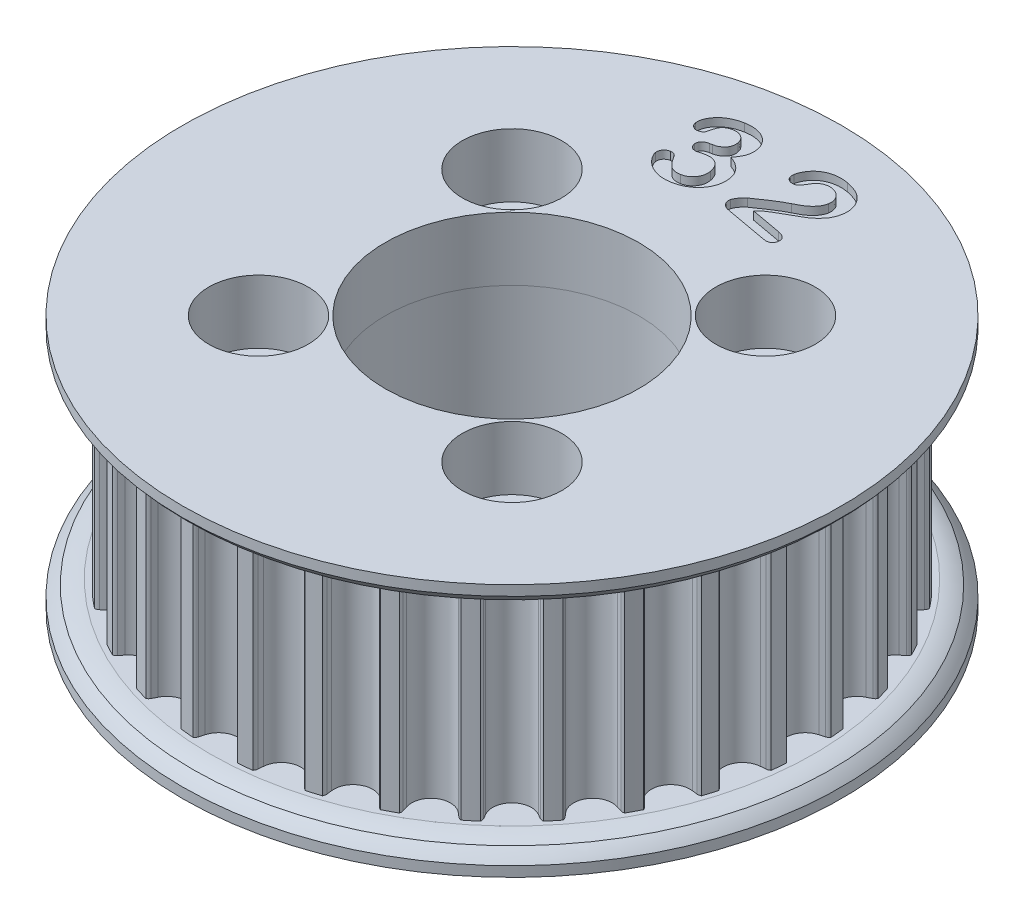
from build123d import *

# Parameters (mm, degrees)
SKETCH1_R                    = 14.897875026
TOOTHOD_DEPTH                = 5.08
TOOTHPROFILE_DEPTH           = 22.672557776
TOOTHPATTERN_COUNT           = 32
LARGE_TOOTH_COUNT_DEPTH      = 27.579130911
LARGE_TOOTH_COUNT_DEPTH_BACK = 0.4
CUT_EXTRUDE1_DEPTH           = 9.525
SKETCH15_R                   = 6.35
BOSS_EXTRUDE1_DEPTH          = 9.525
SKETCH16_R                   = 6.35
SKETCH16_R_2                 = 2.4892
CUT_EXTRUDE2_DEPTH           = 27.579131036
SKETCH17_R                   = 2.0193
CUT_EXTRUDE3_DEPTH           = 26.216776789
CIRPATTERN1_START            = -6.35
CIRPATTERN1_OUTLINE_R        = 2.0193
CIRPATTERN1_DEPTH            = 12.7
CIRPATTERN1_START_2          = 3.175
CIRPATTERN1_2_OUTLINE_R      = 2.4892
CIRPATTERN1_2_OUTLINE_R_2    = 2.0193
CIRPATTERN1_2_DEPTH          = 3.175


# Read off the part's stored shape, not the designer's step: CirPattern1
with BuildPart() as part:
    # Sketch1 → ToothOD (new, symmetric)
    with BuildSketch(Plane(origin=(0, 0, 0), x_dir=(1, 0, 0), z_dir=(0, 1, 0))):
        with Locations(Location((0, 0, 0), (0, 0, 270))):
            Circle(SKETCH1_R)
    extrude(amount=TOOTHOD_DEPTH, both=True)

    # Sketch2 → ToothProfile (cut, symmetric)
    with BuildSketch(Plane(origin=(0, 0, 0), x_dir=(1, 0, 0), z_dir=(0, 1, 0))):
        with BuildLine():
            ThreePointArc((-0.937033068, 14.447937022), (-0.590385173, 13.929762412), (0, 13.729475026))
            ThreePointArc((0, 13.729475026), (0.590385173, 13.929762412), (0.937033068, 14.447937022))
            ThreePointArc((0.937033068, 14.447937022), (0.971699064, 14.574048484), (1.007805813, 14.699755026))
            ThreePointArc((1.007805813, 14.699755026), (1.049505061, 14.78673532), (1.11667299, 14.855965863))
            ThreePointArc((1.11667299, 14.855965863), (0, 14.897875026), (-1.11667299, 14.855965863))
            ThreePointArc((-1.11667299, 14.855965863), (-1.049505061, 14.78673532), (-1.007805813, 14.699755026))
            ThreePointArc((-1.007805813, 14.699755026), (-0.971699064, 14.574048484), (-0.937033068, 14.447937022))
        make_face()
    toothprofile = extrude(amount=TOOTHPROFILE_DEPTH, both=True, mode=Mode.SUBTRACT)

    # ToothPattern: ToothProfile ×32 about axis
    toothpattern_axis = Axis((0, 0, 0), (0, 1, 0))
    for i in range(1, TOOTHPATTERN_COUNT):
        add(toothprofile.rotate(toothpattern_axis, i * 360 / TOOTHPATTERN_COUNT), mode=Mode.SUBTRACT)

    # Sketch4 → Flange (revolve)
    with BuildSketch(Plane.XY, mode=Mode.PRIVATE) as flange_sk:
        with BuildLine():
            Line((0, -5.08), (15.151875026, -5.08))
            ThreePointArc((15.151875026, -5.08), (15.588054604, -5.169791667), (16.002, -5.334))
            ThreePointArc((16.002, -5.334), (16.270284982, -5.573715018), (16.51, -5.842))
            Line((16.51, -5.842), (16.51, -6.35))
            Line((16.51, -6.35), (0, -6.35))
            Line((0, -6.35), (0, -5.08))
        make_face()
        with BuildLine():
            Line((16.51, 6.35), (16.51, 5.842))
            ThreePointArc((16.51, 5.842), (16.270284982, 5.573715018), (16.002, 5.334))
            ThreePointArc((16.002, 5.334), (15.588054604, 5.169791667), (15.151875026, 5.08))
            Line((15.151875026, 5.08), (0, 5.08))
            Line((0, 5.08), (0, 6.35))
            Line((0, 6.35), (16.51, 6.35))
        make_face()
    revolve(flange_sk.sketch.rotate(Axis((0, 8.73125, 0), (0, -1, 0)), 90), axis=Axis((0, 8.73125, 0), (0, -1, 0)))

    # Sketch9 → Large Tooth Count (cut, two sides: drawn at the far end of the back side and taken through both)
    with BuildSketch(Plane(origin=(0, 6.35, 0), x_dir=(1, 0, 0), z_dir=(0, 1, 0)).offset(-LARGE_TOOTH_COUNT_DEPTH_BACK)):
        with BuildLine():
            add(Edge.make_bspline(
                [(-2.395395166, 12.44030561), (-2.351764935, 12.449788273), (-2.26636482, 12.468349267), (-2.148342517, 12.521687794), (-2.042804555, 12.591006059), (-1.96740896, 12.663473497), (-1.915871931, 12.728738206), (-1.883660529, 12.781439315), (-1.858242003, 12.837454575), (-1.840411306, 12.896637263), (-1.829894588, 12.959037271), (-1.825356933, 13.024243133), (-1.828016507, 13.092828085), (-1.835316428, 13.138960651), (-1.839075635, 13.162717329)],
                knots=[0, 0, 0, 0, 1.56408417, 3.061477405, 4.516692484, 5.980328475, 6.71001621, 7.432406507, 8.143441474, 8.864242186, 9.596246751, 10.361021371, 11.155982632, 12, 12, 12, 12], degree=3))
            add(Edge.make_bspline(
                [(-1.839075635, 13.162717329), (-1.847468614, 13.198321462), (-1.863918276, 13.268103117), (-1.912945679, 13.363762957), (-1.979770738, 13.4477246), (-2.063508364, 13.518748482), (-2.161688264, 13.573950381), (-2.272366388, 13.606154076), (-2.39306776, 13.616531188), (-2.474963903, 13.604676737), (-2.517731885, 13.598486079)],
                knots=[0, 0, 0, 0, 0.970242947, 1.901609501, 2.831594879, 3.809017159, 4.805027202, 5.804681963, 6.853556249, 8, 8, 8, 8], degree=3))
            add(Edge.make_bspline(
                [(-2.517731885, 13.598486079), (-2.546415601, 13.592694971), (-2.601323677, 13.581609287), (-2.678208847, 13.55850786), (-2.746350603, 13.530836409), (-2.805384858, 13.497992457), (-2.855844248, 13.460479936), (-2.900373354, 13.421487835), (-2.937064484, 13.378096327), (-2.978986878, 13.315102944), (-3.020518734, 13.221832551), (-3.059478235, 13.098283973), (-3.093381877, 12.968046045), (-3.114639047, 12.880861708), (-3.124950635, 12.838569673)],
                knots=[0, 0, 0, 0, 0.994372717, 1.903487376, 2.72466848, 3.490292993, 4.192582868, 4.858964158, 5.497730828, 6.117954991, 7.426137334, 8.949273991, 10.520130824, 12, 12, 12, 12], degree=3))
            add(Edge.make_bspline(
                [(-3.124950635, 12.838569673), (-3.129102288, 12.828888525), (-3.137555782, 12.809176013), (-3.156946896, 12.781271911), (-3.184316211, 12.757087617), (-3.228365663, 12.724989234), (-3.296869514, 12.693279737), (-3.356792915, 12.679657358), (-3.388376416, 12.672477485)],
                knots=[0, 0, 0, 0, 0.583215557, 1.187529019, 1.864732099, 2.597558886, 4.206693834, 6, 6, 6, 6], degree=3))
            add(Edge.make_bspline(
                [(-3.388376416, 12.672477485), (-3.408006408, 12.670159859), (-3.447059185, 12.665549071), (-3.507022694, 12.67355228), (-3.566425146, 12.693523488), (-3.623655514, 12.725811297), (-3.677136394, 12.767570228), (-3.718303855, 12.823277744), (-3.750834042, 12.887407726), (-3.76148388, 12.935253341), (-3.766995166, 12.960013423)],
                knots=[0, 0, 0, 0, 0.895545026, 1.78163704, 2.722927117, 3.728259503, 4.757347425, 5.780279766, 6.851295854, 8, 8, 8, 8], degree=3))
            add(Edge.make_bspline(
                [(-3.766995166, 12.960013423), (-3.770411448, 12.985862618), (-3.777384046, 13.038620566), (-3.773919219, 13.121047331), (-3.759263587, 13.207335205), (-3.733005125, 13.296987906), (-3.696578666, 13.389099655), (-3.647932397, 13.480993304), (-3.588113382, 13.572735702), (-3.518084365, 13.664428947), (-3.436036471, 13.753650839), (-3.341843972, 13.838087605), (-3.234599648, 13.915677391), (-3.115927699, 13.987966339), (-2.986130398, 14.052791424), (-2.845920922, 14.108605922), (-2.695743201, 14.153101315), (-2.591436102, 14.174340706), (-2.538270166, 14.185166548)],
                knots=[0, 0, 0, 0, 0.657648442, 1.342253878, 2.074039585, 2.864148476, 3.697712609, 4.572156031, 5.485651204, 6.461680898, 7.483386968, 8.543039874, 9.651430748, 10.822328438, 12.049685541, 13.311901225, 14.629860395, 16, 16, 16, 16], degree=3))
            add(Edge.make_bspline(
                [(-2.538270166, 14.185166548), (-2.491323817, 14.192598445), (-2.399252753, 14.207173862), (-2.262542202, 14.218659249), (-2.130523977, 14.21615243), (-2.003510296, 14.205171913), (-1.88150585, 14.182798989), (-1.765492151, 14.149880101), (-1.655706619, 14.106812961), (-1.552939002, 14.053959346), (-1.457386459, 13.992879421), (-1.37142964, 13.922784448), (-1.294282136, 13.845573559), (-1.228614102, 13.759473777), (-1.172184525, 13.667230001), (-1.12544845, 13.569517), (-1.089148427, 13.465869789), (-1.073635459, 13.393899723), (-1.065764698, 13.357384517)],
                knots=[0, 0, 0, 0, 1.205963252, 2.365132143, 3.475536425, 4.552557823, 5.596986774, 6.617881568, 7.608112011, 8.584359298, 9.54600503, 10.480268389, 11.393565618, 12.30907766, 13.221030907, 14.133203077, 15.052849641, 16, 16, 16, 16], degree=3))
            add(Edge.make_bspline(
                [(-1.065764698, 13.357384517), (-1.058444517, 13.309874096), (-1.044223716, 13.217576343), (-1.046060272, 13.080838704), (-1.062999475, 12.95140843), (-1.100190083, 12.829006806), (-1.152753369, 12.710344301), (-1.218197892, 12.591451706), (-1.297956271, 12.471597027), (-1.359266437, 12.394328645), (-1.390805323, 12.35458061)],
                knots=[0, 0, 0, 0, 1.053632123, 2.04687467, 2.990381272, 3.91042597, 4.843946409, 5.835317206, 6.886454128, 8, 8, 8, 8], degree=3))
            add(Edge.make_bspline(
                [(-1.390805323, 12.35458061), (-1.350412041, 12.340545314), (-1.270980886, 12.312945681), (-1.157752588, 12.262979632), (-1.052586502, 12.206626181), (-0.956144809, 12.143795096), (-0.867013097, 12.07655175), (-0.788401054, 12.001417094), (-0.716721652, 11.921931915), (-0.655517404, 11.83490394), (-0.602231291, 11.742811281), (-0.559592513, 11.644667954), (-0.524881708, 11.541361692), (-0.509910371, 11.46953943), (-0.502301416, 11.43303686)],
                knots=[0, 0, 0, 0, 1.139891914, 2.24153439, 3.296229475, 4.31773043, 5.308329865, 6.268443975, 7.212979858, 8.157782482, 9.099914282, 10.045216846, 11.006511264, 12, 12, 12, 12], degree=3))
            add(Edge.make_bspline(
                [(-0.502301416, 11.43303686), (-0.495319451, 11.388490119), (-0.481414307, 11.299771707), (-0.478916202, 11.164667165), (-0.488260491, 11.029415833), (-0.51276627, 10.894860542), (-0.549846959, 10.762327063), (-0.602249742, 10.634138329), (-0.667869204, 10.510393731), (-0.746222597, 10.391484268), (-0.838347041, 10.280067973), (-0.942787724, 10.17663575), (-1.059215889, 10.081986318), (-1.186989884, 9.996266633), (-1.325681923, 9.920701304), (-1.475651654, 9.858916788), (-1.635068246, 9.806633217), (-1.746512528, 9.78436586), (-1.803356885, 9.773007954)],
                knots=[0, 0, 0, 0, 0.919196757, 1.830654129, 2.750292315, 3.682047259, 4.616530511, 5.553871909, 6.502170786, 7.470871317, 8.454707972, 9.446890999, 10.465768377, 11.511964047, 12.582837701, 13.682741819, 14.818036711, 16, 16, 16, 16], degree=3))
            add(Edge.make_bspline(
                [(-1.803356885, 9.773007954), (-1.861273881, 9.764095157), (-1.97457734, 9.746658985), (-2.143413115, 9.740832432), (-2.305966452, 9.751048954), (-2.461225746, 9.778889999), (-2.606979598, 9.821119725), (-2.742928406, 9.873090337), (-2.868308727, 9.934276457), (-2.981900004, 10.005903776), (-3.083286845, 10.085279788), (-3.175837052, 10.166704637), (-3.256567319, 10.253286516), (-3.326556915, 10.341337364), (-3.383639504, 10.428572924), (-3.428783069, 10.510279282), (-3.462785872, 10.585170072), (-3.474766814, 10.634802087), (-3.480352198, 10.657939985)],
                knots=[0, 0, 0, 0, 1.358988971, 2.658600414, 3.911700577, 5.132627013, 6.311151581, 7.428568411, 8.506776026, 9.543649576, 10.538503265, 11.492538343, 12.401569204, 13.281931069, 14.10006001, 14.817332809, 15.448653585, 16, 16, 16, 16], degree=3))
            add(Edge.make_bspline(
                [(-3.480352198, 10.657939985), (-3.483746984, 10.68497257), (-3.490277506, 10.736974917), (-3.483346924, 10.814189742), (-3.459407148, 10.885488216), (-3.420429227, 10.949801807), (-3.370073369, 11.006058136), (-3.308307685, 11.050542415), (-3.238271172, 11.084475844), (-3.186891971, 11.095909843), (-3.160669385, 11.101745454)],
                knots=[0, 0, 0, 0, 1.065165672, 2.049049875, 3.00773798, 3.985592617, 4.976224793, 5.944087156, 6.950716419, 8, 8, 8, 8], degree=3))
            add(Edge.make_bspline(
                [(-3.160669385, 11.101745454), (-3.132597094, 11.104682386), (-3.07565053, 11.110640153), (-3.005449066, 11.091014031), (-2.953679925, 11.068571016), (-2.91939304, 11.047595496), (-2.891337116, 11.023070197), (-2.877833025, 11.003226451), (-2.87134751, 10.993696235)],
                knots=[0, 0, 0, 0, 1.550673656, 3.145647615, 3.957272918, 4.675311549, 5.363801208, 6, 6, 6, 6], degree=3))
            add(Edge.make_bspline(
                [(-2.87134751, 10.993696235), (-2.834765451, 10.934439869), (-2.765769991, 10.822679615), (-2.654254449, 10.673931939), (-2.546873402, 10.549804547), (-2.454600564, 10.465849729), (-2.379391167, 10.412984746), (-2.320630434, 10.38270277), (-2.259082437, 10.358414541), (-2.19377006, 10.341195919), (-2.12514281, 10.331648111), (-2.053345183, 10.329022341), (-1.978350806, 10.333749213), (-1.927728345, 10.341432664), (-1.901583448, 10.345400923)],
                knots=[0, 0, 0, 0, 1.989651524, 3.75257504, 5.30775678, 6.675689646, 7.305821198, 7.929950262, 8.560368956, 9.193937615, 9.855728221, 10.536870827, 11.244340126, 12, 12, 12, 12], degree=3))
            add(Edge.make_bspline(
                [(-1.901583448, 10.345400923), (-1.871644399, 10.352199583), (-1.811653801, 10.36582245), (-1.724531025, 10.397969414), (-1.641916359, 10.442636299), (-1.563158271, 10.496780316), (-1.491100009, 10.561890428), (-1.427079449, 10.636365346), (-1.373201458, 10.72071369), (-1.328532708, 10.813025229), (-1.296080307, 10.912955075), (-1.279366413, 11.018302819), (-1.277092498, 11.127852865), (-1.287926429, 11.200953457), (-1.293471729, 11.238369673)],
                knots=[0, 0, 0, 0, 0.918783497, 1.841019456, 2.770121856, 3.724533536, 4.696473957, 5.670047891, 6.656552307, 7.685126467, 8.733743146, 9.79028542, 10.868967352, 12, 12, 12, 12], degree=3))
            add(Edge.make_bspline(
                [(-1.293471729, 11.238369673), (-1.298936686, 11.265876176), (-1.30961674, 11.319631579), (-1.333478309, 11.396401406), (-1.360287624, 11.468479114), (-1.394965812, 11.533732243), (-1.433076599, 11.593785038), (-1.476357011, 11.648422925), (-1.525805682, 11.69629192), (-1.579318811, 11.739547501), (-1.637253652, 11.775881164), (-1.698731759, 11.806115638), (-1.76434029, 11.827990482), (-1.83303783, 11.844288015), (-1.905487999, 11.853175874), (-1.98114044, 11.854782163), (-2.060573072, 11.849194939), (-2.114159971, 11.840923764), (-2.141792041, 11.836658735)],
                knots=[0, 0, 0, 0, 1.142167213, 2.232114242, 3.272952444, 4.271354239, 5.237162538, 6.16931723, 7.104388237, 8.036542928, 8.968855492, 9.885808178, 10.82190168, 11.781211808, 12.759285311, 13.790748962, 14.860800298, 16, 16, 16, 16], degree=3))
            add(Edge.make_bspline(
                [(-2.141792041, 11.836658735), (-2.152794304, 11.834231238), (-2.177762529, 11.828722342), (-2.219583134, 11.820746399), (-2.268450918, 11.806036359), (-2.322602613, 11.792515486), (-2.374969303, 11.777315582), (-2.420194021, 11.766479519), (-2.454197188, 11.756940782), (-2.473367184, 11.752663579), (-2.481120166, 11.750933735)],
                knots=[0, 0, 0, 0, 0.772488785, 1.753064323, 2.916415325, 4.267721891, 5.579625089, 6.653636691, 7.455485957, 8, 8, 8, 8], degree=3))
            add(Edge.make_bspline(
                [(-2.481120166, 11.750933735), (-2.506960456, 11.746913438), (-2.556158075, 11.739259148), (-2.627480161, 11.7445519), (-2.692385424, 11.758886393), (-2.748894318, 11.788116673), (-2.797532533, 11.827971419), (-2.835684342, 11.879578873), (-2.863495022, 11.941556302), (-2.873931957, 11.987031385), (-2.879384229, 12.010787642)],
                knots=[0, 0, 0, 0, 1.158395447, 2.205482207, 3.158342672, 4.093034092, 5.004217035, 5.930162721, 6.91871368, 8, 8, 8, 8], degree=3))
            add(Edge.make_bspline(
                [(-2.879384229, 12.010787642), (-2.882631581, 12.034581517), (-2.888938576, 12.080793902), (-2.878805561, 12.149340934), (-2.856720158, 12.213565122), (-2.817758689, 12.271771874), (-2.764205594, 12.323365118), (-2.69486753, 12.365228304), (-2.61067647, 12.39742537), (-2.548927529, 12.410824563), (-2.515945948, 12.417981392)],
                knots=[0, 0, 0, 0, 0.930670598, 1.807545321, 2.668967297, 3.556120476, 4.506850782, 5.542439393, 6.687358266, 8, 8, 8, 8], degree=3))
            Line((-2.515945948, 12.417981392), (-2.395395166, 12.44030561))
        make_face()
        with BuildLine():
            Line((1.496615625, 10.596661719), (3.040558594, 10.315376563))
            add(Edge.make_bspline(
                [(3.040558594, 10.315376563), (3.076470418, 10.307529852), (3.14431808, 10.29270518), (3.237910492, 10.259647673), (3.314810362, 10.214619672), (3.376258953, 10.161565269), (3.421206567, 10.100520807), (3.450051698, 10.033069352), (3.459924706, 9.959095721), (3.453664837, 9.90962643), (3.45043125, 9.884072656)],
                knots=[0, 0, 0, 0, 1.314385246, 2.483248006, 3.533178983, 4.483663627, 5.367405748, 6.221602073, 7.081353774, 8, 8, 8, 8], degree=3))
            add(Edge.make_bspline(
                [(3.45043125, 9.884072656), (3.444961292, 9.861219289), (3.434340382, 9.816845352), (3.405482322, 9.754899622), (3.362843684, 9.703056412), (3.312211901, 9.657228683), (3.249546097, 9.623838458), (3.176296577, 9.605064484), (3.093496604, 9.601079944), (3.036016191, 9.609216438), (3.005732812, 9.613503125)],
                knots=[0, 0, 0, 0, 0.959057919, 1.862184029, 2.762603093, 3.684857112, 4.637180914, 5.631458474, 6.752141176, 8, 8, 8, 8], degree=3))
            Line((3.005732812, 9.613503125), (0.834032812, 10.008195313))
            add(Edge.make_bspline(
                [(0.834032812, 10.008195313), (0.799163966, 10.01595986), (0.732766902, 10.030745068), (0.642318567, 10.070362747), (0.567285441, 10.124046885), (0.507994511, 10.189554013), (0.465616838, 10.262800945), (0.437487267, 10.339157189), (0.427085453, 10.418934404), (0.433438937, 10.471680098), (0.436661719, 10.498435156)],
                knots=[0, 0, 0, 0, 1.213696302, 2.311113739, 3.33440628, 4.331286816, 5.293760978, 6.197287054, 7.085580533, 8, 8, 8, 8], degree=3))
            add(Edge.make_bspline(
                [(0.436661719, 10.498435156), (0.44113245, 10.517092061), (0.450927104, 10.55796634), (0.480593947, 10.619569477), (0.517946299, 10.689367879), (0.566975791, 10.762212902), (0.620934828, 10.834331531), (0.676255614, 10.900345371), (0.732255923, 10.956275524), (0.77210726, 10.987251868), (0.791170312, 11.002069531)],
                knots=[0, 0, 0, 0, 0.73413026, 1.608361423, 2.609947524, 3.772309139, 4.971338235, 6.065032966, 7.074400508, 8, 8, 8, 8], degree=3))
            add(Edge.make_bspline(
                [(0.791170312, 11.002069531), (0.866962318, 11.055506875), (1.013806864, 11.159039993), (1.228848625, 11.306818186), (1.432353271, 11.440362051), (1.593594202, 11.543173644), (1.71386318, 11.618765143), (1.795973475, 11.668863223), (1.871533756, 11.713095185), (1.939959813, 11.752742621), (2.001297798, 11.787792166), (2.056499784, 11.817040794), (2.104597411, 11.841464707), (2.134742615, 11.85495609), (2.148482812, 11.861105469)],
                knots=[0, 0, 0, 0, 2.076286751, 4.022738109, 5.841539434, 7.525706709, 8.304174298, 9.021940097, 9.679141635, 10.264386048, 10.792591321, 11.260659723, 11.663008358, 12, 12, 12, 12], degree=3))
            add(Edge.make_bspline(
                [(2.148482812, 11.861105469), (2.192706975, 11.882190765), (2.278406252, 11.923050661), (2.400603528, 11.988337279), (2.512124748, 12.055970048), (2.613831073, 12.126012776), (2.705978014, 12.198152933), (2.788926098, 12.273162333), (2.860996139, 12.352152812), (2.925064114, 12.432473328), (2.978920615, 12.515058351), (3.020703701, 12.599886896), (3.054371063, 12.684681647), (3.066652771, 12.743129295), (3.072705469, 12.771933594)],
                knots=[0, 0, 0, 0, 1.309285269, 2.537183194, 3.700941637, 4.793226826, 5.835618559, 6.826659668, 7.778117931, 8.690044814, 9.570477442, 10.40652055, 11.214697947, 12, 12, 12, 12], degree=3))
            add(Edge.make_bspline(
                [(3.072705469, 12.771933594), (3.077045195, 12.802517658), (3.08557015, 12.862596973), (3.085032021, 12.952655893), (3.06992249, 13.039653397), (3.044465016, 13.123287094), (3.007335811, 13.201844988), (2.961999685, 13.275372781), (2.904891797, 13.340491842), (2.839619482, 13.39889567), (2.766488225, 13.448098243), (2.688362349, 13.490342001), (2.603553141, 13.520577547), (2.544530415, 13.533389685), (2.5146, 13.539886719)],
                knots=[0, 0, 0, 0, 1.048430709, 2.059536561, 3.043538049, 4.03813078, 5.019687928, 5.987453245, 6.96237482, 7.950626426, 8.954579394, 9.949583156, 10.960233954, 12, 12, 12, 12], degree=3))
            add(Edge.make_bspline(
                [(2.5146, 13.539886719), (2.482820674, 13.54448865), (2.420671914, 13.553488348), (2.327939553, 13.55436703), (2.238730534, 13.543786238), (2.152821856, 13.521121308), (2.070041803, 13.486714282), (1.99030555, 13.441126644), (1.914677836, 13.383087672), (1.868529839, 13.337981126), (1.844873437, 13.314858594)],
                knots=[0, 0, 0, 0, 1.041995574, 2.037762919, 3.001819629, 3.951470224, 4.913731895, 5.905361163, 6.926245566, 8, 8, 8, 8], degree=3))
            add(Edge.make_bspline(
                [(1.844873437, 13.314858594), (1.836962752, 13.305462185), (1.817025803, 13.281780835), (1.786604762, 13.234083654), (1.746619453, 13.16957223), (1.701353572, 13.09081871), (1.652304826, 13.008995963), (1.599262762, 12.934818624), (1.545778336, 12.87266957), (1.49317075, 12.819527194), (1.434837571, 12.779725159), (1.367500147, 12.758406911), (1.293160743, 12.751011076), (1.242068056, 12.758297723), (1.215330469, 12.762110938)],
                knots=[0, 0, 0, 0, 0.490086648, 1.23514352, 2.254462762, 3.522463602, 4.861828676, 6.062585089, 7.158452149, 8.133567385, 9.043474829, 9.94558515, 10.924893206, 12, 12, 12, 12], degree=3))
            add(Edge.make_bspline(
                [(1.215330469, 12.762110938), (1.1918008, 12.767409863), (1.145864513, 12.777754801), (1.083403861, 12.809054218), (1.029226098, 12.850852466), (0.985428581, 12.903944097), (0.952990379, 12.965964312), (0.934113845, 13.035639936), (0.928767472, 13.112079072), (0.935749543, 13.16430178), (0.939403125, 13.191628906)],
                knots=[0, 0, 0, 0, 1.005735255, 1.963467701, 2.894942414, 3.849838088, 4.818834576, 5.800546011, 6.849068571, 8, 8, 8, 8], degree=3))
            add(Edge.make_bspline(
                [(0.939403125, 13.191628906), (0.94695919, 13.226372907), (0.962245997, 13.296664108), (1.000256812, 13.400153913), (1.04856227, 13.50383482), (1.107973434, 13.60708464), (1.179327685, 13.706743847), (1.261023938, 13.800680193), (1.354522548, 13.88561604), (1.455861058, 13.964943482), (1.569265613, 14.034125276), (1.693586214, 14.091505787), (1.827880808, 14.139532123), (1.972635001, 14.174976968), (2.127793885, 14.19738943), (2.292899535, 14.204363143), (2.467541024, 14.194376892), (2.585869916, 14.175547174), (2.646759375, 14.165857813)],
                knots=[0, 0, 0, 0, 0.778623011, 1.575245933, 2.410124108, 3.284189594, 4.182255238, 5.09314751, 6.007422066, 6.94709478, 7.9105916, 8.911814582, 9.943694323, 11.032469103, 12.172997958, 13.374709305, 14.649082835, 16, 16, 16, 16], degree=3))
            add(Edge.make_bspline(
                [(2.646759375, 14.165857813), (2.719162228, 14.150908352), (2.859098956, 14.122014759), (3.056086837, 14.056987574), (3.234831122, 13.97904578), (3.340195258, 13.910703589), (3.391495312, 13.877428906)],
                knots=[0, 0, 0, 0, 1.10182767, 2.12955916, 3.089313288, 4, 4, 4, 4], degree=3))
            add(Edge.make_bspline(
                [(3.391495312, 13.877428906), (3.422130205, 13.854896901), (3.482988067, 13.810135862), (3.563994851, 13.730952279), (3.638997687, 13.646231282), (3.704528082, 13.552931595), (3.762949243, 13.454554394), (3.810101114, 13.349741993), (3.849241088, 13.240701726), (3.87594831, 13.126759136), (3.894541231, 13.010978885), (3.900291629, 12.894319628), (3.896470494, 12.777654807), (3.884875953, 12.700716463), (3.87905625, 12.662098437)],
                knots=[0, 0, 0, 0, 0.989601704, 1.965896975, 2.944161331, 3.933975698, 4.931476062, 5.920469902, 6.923591216, 7.944892093, 8.964867275, 9.974442286, 10.983302259, 12, 12, 12, 12], degree=3))
            add(Edge.make_bspline(
                [(3.87905625, 12.662098437), (3.866169811, 12.602664581), (3.840777325, 12.48555128), (3.773651638, 12.320167998), (3.688108563, 12.165898311), (3.579162293, 12.029559915), (3.463688662, 11.90680358), (3.348390019, 11.798394421), (3.235730394, 11.705184883), (3.13917087, 11.639342083), (3.057242007, 11.591902158), (2.989711036, 11.549852641), (2.911340993, 11.505758413), (2.824482157, 11.45595952), (2.72861257, 11.40099989), (2.623071205, 11.34260014), (2.509348807, 11.277865659), (2.38847295, 11.212015268), (2.268459364, 11.145361649), (2.155554631, 11.079785794), (2.052040051, 11.018057588), (1.957177451, 10.960936398), (1.873570422, 10.904701617), (1.797934742, 10.854509569), (1.733071528, 10.806322664), (1.693584005, 10.774761348), (1.675209375, 10.760075)],
                knots=[0, 0, 0, 0, 1.453984622, 2.865049479, 4.256733719, 5.664048518, 7.030772165, 8.291537635, 9.451615229, 10.529147169, 11.085384378, 11.718642237, 12.433929054, 13.238513743, 14.116484075, 15.080257941, 16.127126092, 17.250147251, 18.376624458, 19.414645574, 20.376757237, 21.263108444, 22.065796271, 22.789417081, 23.436682463, 24, 24, 24, 24], degree=3))
            add(Edge.make_bspline(
                [(1.675209375, 10.760075), (1.645896999, 10.736150025), (1.583293421, 10.685052527), (1.526707024, 10.627347813), (1.496615625, 10.596661719)],
                knots=[0, 0, 0, 0, 0.936444089, 2, 2, 2, 2], degree=3))
        make_face()
    extrude(amount=LARGE_TOOTH_COUNT_DEPTH + LARGE_TOOTH_COUNT_DEPTH_BACK, mode=Mode.SUBTRACT)

    # Sketch14 → Cut-Extrude1 (cut)
    with BuildSketch(Plane.XZ.offset(6.35)):
        with BuildLine():
            Line((-4.7625, -11.1125), (4.7625, -11.1125))
            ThreePointArc((4.7625, -11.1125), (9.252628061, -9.252628061), (11.1125, -4.7625))
            Line((11.1125, -4.7625), (11.1125, 4.7625))
            ThreePointArc((11.1125, 4.7625), (9.252628061, 9.252628061), (4.7625, 11.1125))
            Line((4.7625, 11.1125), (-4.7625, 11.1125))
            ThreePointArc((-4.7625, 11.1125), (-9.252628061, 9.252628061), (-11.1125, 4.7625))
            Line((-11.1125, 4.7625), (-11.1125, -4.7625))
            ThreePointArc((-11.1125, -4.7625), (-9.252628061, -9.252628061), (-4.7625, -11.1125))
        make_face()
    extrude(amount=-CUT_EXTRUDE1_DEPTH, mode=Mode.SUBTRACT)

    # Sketch16 → Cut-Extrude2 (cut, through all)
    with BuildSketch(Plane(origin=(0, 6.35, 0), x_dir=(1, 0, 0), z_dir=(0, 1, 0))):
        with Locations(Location((0, 0, 0), (0, 0, 270))):
            Circle(SKETCH16_R)
        with Locations(Location((6.35, -6.35, 0), (0, 0, 270))):
            Circle(SKETCH16_R_2)
    extrude(amount=-CUT_EXTRUDE2_DEPTH, mode=Mode.SUBTRACT)


with BuildPart() as body_2:
    # Sketch15 → Boss-Extrude1 (new body)
    with BuildSketch(Plane.XZ.offset(-3.175)):
        with BuildLine():
            Line((11.1125, -4.7625), (11.1125, 4.7625))
            ThreePointArc((11.1125, 4.7625), (9.252628061, 9.252628061), (4.7625, 11.1125))
            Line((4.7625, 11.1125), (-4.7625, 11.1125))
            ThreePointArc((-4.7625, 11.1125), (-9.252628061, 9.252628061), (-11.1125, 4.7625))
            Line((-11.1125, 4.7625), (-11.1125, -4.7625))
            ThreePointArc((-11.1125, -4.7625), (-9.252628061, -9.252628061), (-4.7625, -11.1125))
            Line((-4.7625, -11.1125), (4.7625, -11.1125))
            ThreePointArc((4.7625, -11.1125), (9.252628061, -9.252628061), (11.1125, -4.7625))
        make_face()
        with Locations(Location((0, 0, 0), (0, 0, 90))):
            Circle(SKETCH15_R, mode=Mode.SUBTRACT)
    extrude(amount=BOSS_EXTRUDE1_DEPTH)

    # Sketch17 → Cut-Extrude3 (cut, through all)
    with BuildSketch(Plane(origin=(0, 3.175, 0), x_dir=(1, 0, 0), z_dir=(0, 1, 0))):
        with Locations(Location((6.35, -6.35, 0), (0, 0, 270))):
            Circle(SKETCH17_R)
    extrude(amount=-CUT_EXTRUDE3_DEPTH, mode=Mode.SUBTRACT)


with BuildPart() as cirpattern1_tool:
    # CirPattern1 outline → CirPattern1 (new body)
    with BuildSketch(Plane(origin=(0, 0, 0), x_dir=(1, 0, 0), z_dir=(0, 1, 0)).offset(CIRPATTERN1_START)):
        with Locations((6.35, 6.35)):
            Circle(CIRPATTERN1_OUTLINE_R)
        with Locations((-6.35, 6.35)):
            Circle(CIRPATTERN1_OUTLINE_R)
        with Locations((-6.35, -6.35)):
            Circle(CIRPATTERN1_OUTLINE_R)
    extrude(amount=CIRPATTERN1_DEPTH)


with BuildPart() as part_1:
    add(part.part)

    # CirPattern1: cut by cirpattern1_tool
    add(cirpattern1_tool.part, mode=Mode.SUBTRACT)

    # CirPattern1 2 outline → CirPattern1 2 (cut)
    # profile 1 of 3: a face of its own
    with BuildSketch(Plane(origin=(0, 0, 0), x_dir=(1, 0, 0), z_dir=(0, 1, 0)).offset(CIRPATTERN1_START_2)):
        with Locations((6.35, 6.35)):
            Circle(CIRPATTERN1_2_OUTLINE_R)
        with Locations((6.35, 6.35)):
            Circle(CIRPATTERN1_2_OUTLINE_R_2, mode=Mode.SUBTRACT)
    # profile 2 of 3: a face of its own
    with BuildSketch(Plane(origin=(0, 0, 0), x_dir=(1, 0, 0), z_dir=(0, 1, 0)).offset(CIRPATTERN1_START_2)):
        with Locations((-6.35, 6.35)):
            Circle(CIRPATTERN1_2_OUTLINE_R)
        with Locations((-6.35, 6.35)):
            Circle(CIRPATTERN1_2_OUTLINE_R_2, mode=Mode.SUBTRACT)
    # profile 3 of 3: a face of its own
    with BuildSketch(Plane(origin=(0, 0, 0), x_dir=(1, 0, 0), z_dir=(0, 1, 0)).offset(CIRPATTERN1_START_2)):
        with Locations((-6.35, -6.35)):
            Circle(CIRPATTERN1_2_OUTLINE_R)
        with Locations((-6.35, -6.35)):
            Circle(CIRPATTERN1_2_OUTLINE_R_2, mode=Mode.SUBTRACT)
    extrude(amount=CIRPATTERN1_2_DEPTH, mode=Mode.SUBTRACT)


with BuildPart() as body_2_1:
    add(body_2.part)

    # CirPattern1: cut by cirpattern1_tool
    add(cirpattern1_tool.part, mode=Mode.SUBTRACT)


solid = Compound([part_1.part, body_2_1.part])
